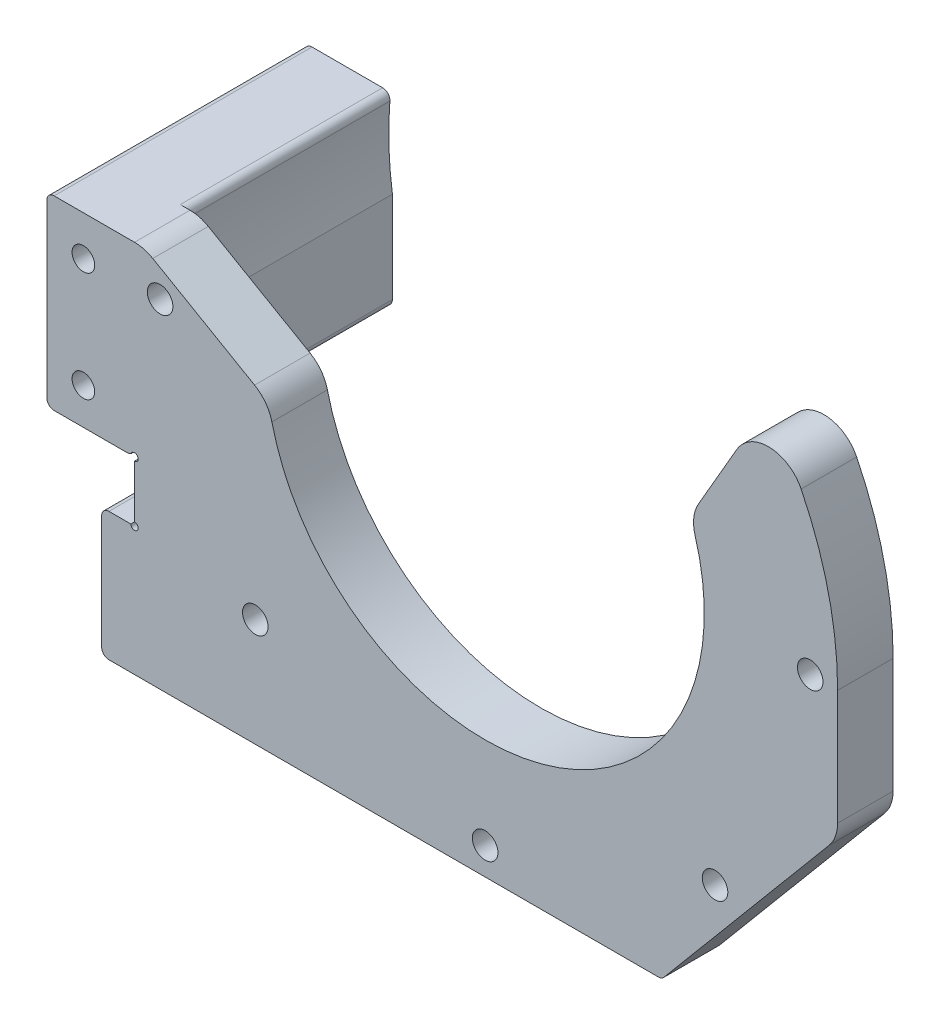
from build123d import *

# Parameters (mm, degrees)
SKETCH_1_R          = 1.75
SKETCH_1_R_2        = 1.55
EXTRUDE_1_DEPTH     = 7.6
SKETCH_2_R          = 0.5
CUT_EXTRUDE_1_DEPTH = 10
FILLET_1_R          = 5
EXTRUDE_START       = 27.7
SKETCH_4_R          = 1.55
EXTRUDE_2_DEPTH     = 27.7
SKETCH_6_R          = 2.5
CUT_EXTRUDE_2_DEPTH = 5
FILLET_START        = -29
FILLET_2_DEPTH      = 29
FILLET_2_2_DEPTH    = 9


with BuildPart() as part:
    # 草图1 → 凸台-拉伸1 (new body)
    with BuildSketch(Plane.XY):
        with BuildLine():
            Line((48.25, -17.561563803), (48.25, 0))
            ThreePointArc((48.25, 0), (45.781945765, 15.234038926), (38.630271835, 28.909593528))
            Line((38.630271835, 28.909593528), (28.062669438, 10.605969263))
            ThreePointArc((28.062669438, 10.605969263), (7.764571353, -28.977774789), (-29.605969263, -4.846295906))
            Line((-29.605969263, -4.846295906), (-46.660254038, 5))
            Line((-46.660254038, 5), (-60, 5))
            Line((-60, 5), (-60, -20.45))
            Line((-60, -20.45), (-48, -20.45))
            Line((-48, -20.45), (-48, -28.65))
            Line((-48, -28.65), (-52.5, -28.65))
            Line((-52.5, -28.65), (-52.5, -46.25))
            Line((-52.5, -46.25), (24.177543768, -46.25))
            Line((24.177543768, -46.25), (48.25, -17.561563803))
        make_face()
        with Locations(Location((-31.466251763, -31.466251763, 0), (0, 0, 180))):
            Circle(SKETCH_1_R, mode=Mode.SUBTRACT)
        with Locations(Location((-55, -15.45, 0), (0, 0, 180))):
            Circle(SKETCH_1_R_2, mode=Mode.SUBTRACT)
        with Locations(Location((0, -42.5, 0), (0, 0, 180))):
            Circle(SKETCH_1_R, mode=Mode.SUBTRACT)
        with Locations(Location((31.466251763, -31.466251763, 0), (0, 0, 180))):
            Circle(SKETCH_1_R, mode=Mode.SUBTRACT)
        with Locations(Location((-55, -0.45, 0), (0, 0, 180))):
            Circle(SKETCH_1_R_2, mode=Mode.SUBTRACT)
        with Locations(Location((-44.5, 0, 0), (0, 0, 180))):
            Circle(SKETCH_1_R, mode=Mode.SUBTRACT)
        with Locations(Location((44.5, 0, 0), (0, 0, 180))):
            Circle(SKETCH_1_R, mode=Mode.SUBTRACT)
    extrude(amount=EXTRUDE_1_DEPTH)

    # 草图2 → 切除-拉伸1 (cut)
    with BuildSketch(Plane(origin=(0, 0, 0), x_dir=(-1, 0, 0), z_dir=(0, 0, -1))):
        with Locations((48, -20.45)):
            Circle(SKETCH_2_R)
        with Locations((48, -28.65)):
            Circle(SKETCH_2_R)
    extrude(amount=-CUT_EXTRUDE_1_DEPTH, mode=Mode.SUBTRACT)

    # 圆角1
    fillet_1_edges = [part.edges().sort_by_distance(p)[0] for p in [
        (48.25, -17.561563803, 3.8),
        (-46.660254038, 5, 3.8),
        (-29.605969263, -4.846295906, 3.8),
        (28.062669438, 10.605969263, 3.8),
        (38.630271835, 28.909593528, 3.8),
    ]]
    fillet(fillet_1_edges, radius=FILLET_1_R)

    # 草图4 → 凸台-拉伸2 (add)
    with BuildSketch(Plane(origin=(0, 0, 0), x_dir=(-1, 0, 0), z_dir=(0, 0, -1)).offset(EXTRUDE_START)):
        with BuildLine():
            Line((60, 5), (48.241579576, 5))
            ThreePointArc((48.241579576, 5), (48.490086253, -0.980579006), (48, -6.946221995))
            Line((48, -6.946221995), (48, -20.45))
            Line((48, -20.45), (60, -20.45))
            Line((60, -20.45), (60, 5))
        make_face()
        with Locations((55, -15.45)):
            Circle(SKETCH_4_R, mode=Mode.SUBTRACT)
        with Locations((55, -0.45)):
            Circle(SKETCH_4_R, mode=Mode.SUBTRACT)
    extrude(amount=-EXTRUDE_2_DEPTH)

    # 草图6 → 切除-拉伸2 (cut)
    with BuildSketch(Plane.XZ.offset(20.45)):
        with Locations(Location((-55, -21.35, 0), (0, 0, 270))):
            Circle(SKETCH_6_R)
        with Locations(Location((-55, -6.35, 0), (0, 0, 270))):
            Circle(SKETCH_6_R)
    extrude(amount=-CUT_EXTRUDE_2_DEPTH, mode=Mode.SUBTRACT)

    # 圆角2: read off the stored shape, not the designer's step
    # 圆角2 outline → 圆角2 (cut)
    with BuildSketch(Plane.XY.offset(FILLET_START)):
        with BuildLine():
            Line((-49, -20.45), (-48, -20.45))
            Line((-48, -20.45), (-48, -19.45))
            ThreePointArc((-48, -19.45), (-48.292893219, -20.157106781), (-49, -20.45))
        make_face()
        with BuildLine():
            Line((-60, -20.45), (-59, -20.45))
            ThreePointArc((-59, -20.45), (-59.707106781, -20.157106781), (-60, -19.45))
            Line((-60, -19.45), (-60, -20.45))
        make_face()
        with BuildLine():
            Line((-60, 5), (-60, 4))
            ThreePointArc((-60, 4), (-59.707106781, 4.707106781), (-59, 5))
            Line((-59, 5), (-60, 5))
        make_face()
        with BuildLine():
            ThreePointArc((-49.338119137, 5), (-48.602997351, 4.67793507), (-48.341389458, 3.919191919))
            ThreePointArc((-48.341389458, 3.919191919), (-48.294508108, 4.45987518), (-48.241579576, 5))
            Line((-48.241579576, 5), (-49.338119137, 5))
        make_face()
    extrude(amount=FILLET_2_DEPTH, mode=Mode.SUBTRACT)

    # Fillet 2 2 outline → Fillet 2 2 (cut)
    with BuildSketch(Plane.XY):
        with BuildLine():
            ThreePointArc((-48.477859457, -20.302859457), (-48.728761597, -20.412512196), (-49, -20.45))
            Line((-49, -20.45), (-48.5, -20.45))
            ThreePointArc((-48.5, -20.45), (-48.494433883, -20.375601507), (-48.477859457, -20.302859457))
        make_face()
        with BuildLine():
            Line((-60, -20.45), (-59, -20.45))
            ThreePointArc((-59, -20.45), (-59.707106781, -20.157106781), (-60, -19.45))
            Line((-60, -19.45), (-60, -20.45))
        make_face()
        with BuildLine():
            Line((-60, 5), (-60, 4))
            ThreePointArc((-60, 4), (-59.707106781, 4.707106781), (-59, 5))
            Line((-59, 5), (-60, 5))
        make_face()
        with BuildLine():
            Line((-52.5, -28.65), (-52.5, -29.65))
            ThreePointArc((-52.5, -29.65), (-52.207106781, -28.942893219), (-51.5, -28.65))
            Line((-51.5, -28.65), (-52.5, -28.65))
        make_face()
        with BuildLine():
            Line((-52.5, -46.25), (-51.5, -46.25))
            ThreePointArc((-51.5, -46.25), (-52.207106781, -45.957106781), (-52.5, -45.25))
            Line((-52.5, -45.25), (-52.5, -46.25))
        make_face()
        with BuildLine():
            ThreePointArc((24.477280553, -45.89278761), (24.133854372, -46.156307787), (23.71123611, -46.25))
            Line((23.71123611, -46.25), (24.177543768, -46.25))
            Line((24.177543768, -46.25), (24.477280553, -45.89278761))
        make_face()
    extrude(amount=FILLET_2_2_DEPTH, mode=Mode.SUBTRACT)


solid = part.part
